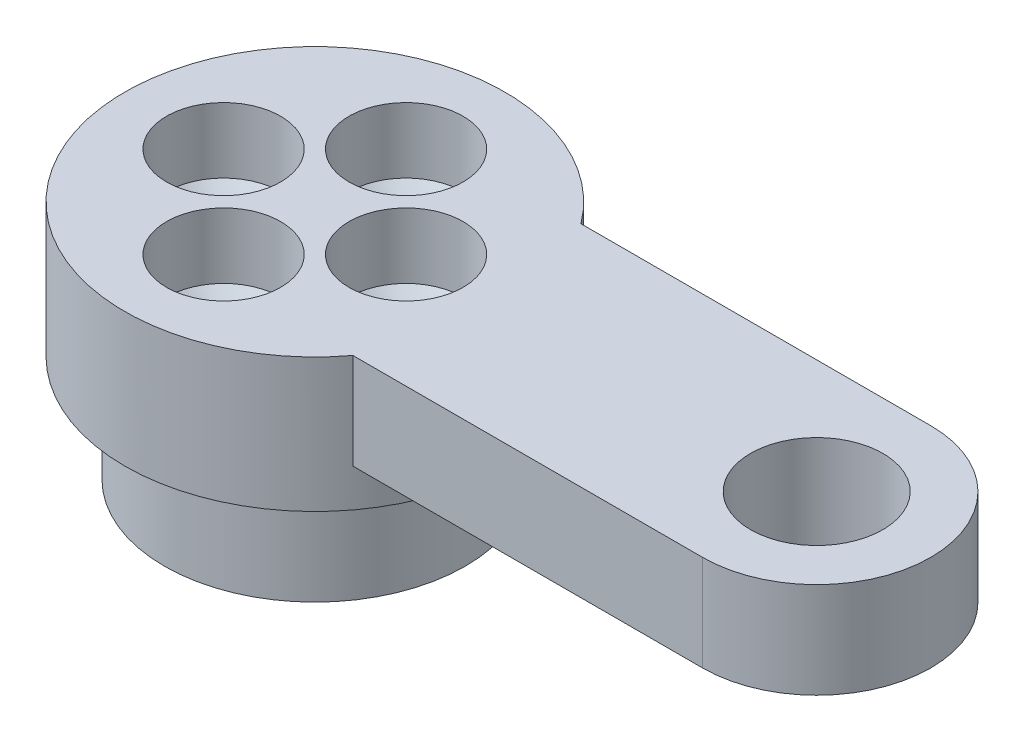
from build123d import *

# Parameters (mm, degrees)
SKETCH_1_R      = 9.9
SKETCH_1_R_2    = 1.85
EXTRUDE_1_DEPTH = 7
SKETCH_2_R      = 12.5
SKETCH_2_R_2    = 1.85
EXTRUDE_2_DEPTH = 2.5
SKETCH_3_R      = 3.75
EXTRUDE_3_DEPTH = 6.3
CHAMFER_1_SIZE  = 2


with BuildPart() as part:
    # 草图1 → 凸台-拉伸1 (new body)
    with BuildSketch(Plane(origin=(0, 0, 0), x_dir=(1, 0, 0), z_dir=(0, 1, 0))):
        with Locations(Location((0, 0, 0), (0, 0, 270))):
            Circle(SKETCH_1_R)
        with Locations(Location((6, 0, 0), (0, 0, 270))):
            Circle(SKETCH_1_R_2, mode=Mode.SUBTRACT)
        with Locations(Location((0, -6, 0), (0, 0, 270))):
            Circle(SKETCH_1_R_2, mode=Mode.SUBTRACT)
        with Locations(Location((-6, 0, 0), (0, 0, 270))):
            Circle(SKETCH_1_R_2, mode=Mode.SUBTRACT)
        with Locations(Location((0, 6, 0), (0, 0, 270))):
            Circle(SKETCH_1_R_2, mode=Mode.SUBTRACT)
    extrude(amount=EXTRUDE_1_DEPTH)

    # 草图2 → 凸台-拉伸2 (add)
    with BuildSketch(Plane(origin=(0, 7, 0), x_dir=(1, 0, 0), z_dir=(0, 1, 0))):
        with Locations(Location((0, 0, 0), (0, 0, 270))):
            Circle(SKETCH_2_R)
        with Locations(Location((-6, 0, 0), (0, 0, 270))):
            Circle(SKETCH_2_R_2, mode=Mode.SUBTRACT)
        with Locations(Location((0, -6, 0), (0, 0, 270))):
            Circle(SKETCH_2_R_2, mode=Mode.SUBTRACT)
        with Locations(Location((6, 0, 0), (0, 0, 270))):
            Circle(SKETCH_2_R_2, mode=Mode.SUBTRACT)
        with Locations(Location((0, 6, 0), (0, 0, 270))):
            Circle(SKETCH_2_R_2, mode=Mode.SUBTRACT)
    extrude(amount=EXTRUDE_2_DEPTH)

    # 草图3 → 凸台-拉伸3 (add)
    # profile 1 of 8: a face of its own
    with BuildSketch(Plane(origin=(0, 9.5, 0), x_dir=(1, 0, 0), z_dir=(0, 1, 0))):
        with BuildLine():
            Line((2.25, 0), (-2.25, 0))
            ThreePointArc((-2.25, 0), (-6, -3.75), (-9.75, 0))
            Line((-9.75, 0), (-12.5, 0))
            ThreePointArc((-12.5, 0), (-3.952847075, -11.858541226), (10, -7.5))
            ThreePointArc((10, -7.5), (11.858541226, -3.952847075), (12.5, 0))
            Line((12.5, 0), (9.75, 0))
            ThreePointArc((9.75, 0), (6, -3.75), (2.25, 0))
        make_face()
        with Locations(Location((0, -6, 0), (0, 0, 270))):
            Circle(SKETCH_3_R, mode=Mode.SUBTRACT)
    # profile 2 of 8: a face of its own
    with BuildSketch(Plane(origin=(0, 9.5, 0), x_dir=(1, 0, 0), z_dir=(0, 1, 0))):
        with BuildLine():
            ThreePointArc((-9.75, 0), (-6, 3.75), (-2.25, 0))
            Line((-2.25, 0), (2.25, 0))
            ThreePointArc((2.25, 0), (6, 3.75), (9.75, 0))
            Line((9.75, 0), (12.5, 0))
            ThreePointArc((12.5, 0), (11.858541226, 3.952847075), (10, 7.5))
            ThreePointArc((10, 7.5), (-3.952847075, 11.858541226), (-12.5, 0))
            Line((-12.5, 0), (-9.75, 0))
        make_face()
        with Locations(Location((0, 6, 0), (0, 0, 270))):
            Circle(SKETCH_3_R, mode=Mode.SUBTRACT)
    # profile 3 of 8: a face of its own
    with BuildSketch(Plane(origin=(0, 9.5, 0), x_dir=(1, 0, 0), z_dir=(0, 1, 0))):
        with BuildLine():
            ThreePointArc((10, 7.5), (11.858541226, 3.952847075), (12.5, 0))
            Line((12.5, 0), (25.5, 0))
            ThreePointArc((25.5, 0), (27.696699141, 5.303300859), (33, 7.5))
            Line((33, 7.5), (10, 7.5))
        make_face()
    # profile 4 of 8: a face of its own
    with BuildSketch(Plane(origin=(0, 9.5, 0), x_dir=(1, 0, 0), z_dir=(0, 1, 0))):
        with BuildLine():
            Line((25.5, 0), (12.5, 0))
            ThreePointArc((12.5, 0), (11.858541226, -3.952847075), (10, -7.5))
            Line((10, -7.5), (33, -7.5))
            ThreePointArc((33, -7.5), (27.696699141, -5.303300859), (25.5, 0))
        make_face()
    # profile 5 of 8: a face of its own
    with BuildSketch(Plane(origin=(0, 9.5, 0), x_dir=(1, 0, 0), z_dir=(0, 1, 0))):
        with BuildLine():
            ThreePointArc((33, 7.5), (27.696699141, 5.303300859), (25.5, 0))
            Line((25.5, 0), (28.65, 0))
            ThreePointArc((28.65, 0), (33, 4.35), (37.35, 0))
            Line((37.35, 0), (40.5, 0))
            ThreePointArc((40.5, 0), (38.303300859, 5.303300859), (33, 7.5))
        make_face()
    # profile 6 of 8: a face of its own
    with BuildSketch(Plane(origin=(0, 9.5, 0), x_dir=(1, 0, 0), z_dir=(0, 1, 0))):
        with BuildLine():
            Line((28.65, 0), (25.5, 0))
            ThreePointArc((25.5, 0), (27.696699141, -5.303300859), (33, -7.5))
            ThreePointArc((33, -7.5), (38.303300859, -5.303300859), (40.5, 0))
            Line((40.5, 0), (37.35, 0))
            ThreePointArc((37.35, 0), (33, -4.35), (28.65, 0))
        make_face()
    # profile 7 of 8: a face of its own
    with BuildSketch(Plane(origin=(0, 9.5, 0), x_dir=(1, 0, 0), z_dir=(0, 1, 0))):
        with BuildLine():
            ThreePointArc((33, 7.5), (27.696699141, 5.303300859), (25.5, 0))
            Line((25.5, 0), (28.65, 0))
            ThreePointArc((28.65, 0), (33, 4.35), (37.35, 0))
            Line((37.35, 0), (40.5, 0))
            ThreePointArc((40.5, 0), (38.303300859, 5.303300859), (33, 7.5))
        make_face()
    # profile 8 of 8: a face of its own
    with BuildSketch(Plane(origin=(0, 9.5, 0), x_dir=(1, 0, 0), z_dir=(0, 1, 0))):
        with BuildLine():
            Line((28.65, 0), (25.5, 0))
            ThreePointArc((25.5, 0), (27.696699141, -5.303300859), (33, -7.5))
            ThreePointArc((33, -7.5), (38.303300859, -5.303300859), (40.5, 0))
            Line((40.5, 0), (37.35, 0))
            ThreePointArc((37.35, 0), (33, -4.35), (28.65, 0))
        make_face()
    extrude(amount=EXTRUDE_3_DEPTH)

    # 倒角1
    # the kernel refuses this chamfer: 2 mm, written as the material it adds along each edge
    with BuildSketch(Plane(origin=(0, 9.5, 6), x_dir=(0, 0, 1), z_dir=(-1, 0, 0))) as chamfer_1_piece_1_section:
        Polygon((3.75 - CHAMFER_1_SIZE, 0), (3.75, CHAMFER_1_SIZE), (3.75, 0), align=None)
    chamfer_1_piece_1 = revolve(axis=Axis((0, 9.5, 6), (0, 1, 0)), mode=Mode.PRIVATE)
    chamfer_1_piece_1 = chamfer_1_piece_1 - Plane(origin=(0, 10.553600351, 6), x_dir=(0, 0, 1), z_dir=(0, -1, 0)) * Cylinder(1.85, 15, mode=Mode.PRIVATE)
    add(chamfer_1_piece_1)
    with BuildSketch(Plane(origin=(-6, 9.5, 0), x_dir=(-1, 0, 0), z_dir=(0, 0, 1))) as chamfer_1_piece_2_section:
        Polygon((3.75 - CHAMFER_1_SIZE, 0), (3.75, -CHAMFER_1_SIZE), (3.75, 0), align=None)
    chamfer_1_piece_2 = revolve(axis=Axis((-6, 9.5, 0), (0, -1, 0)), mode=Mode.PRIVATE)
    chamfer_1_piece_2 = chamfer_1_piece_2 - Plane(origin=(-6, 10.553600351, 0), x_dir=(0, 0, 1), z_dir=(0, -1, 0)) * Cylinder(1.85, 15, mode=Mode.PRIVATE)
    add(chamfer_1_piece_2)
    with BuildSketch(Plane(origin=(0, 9.5, -6), x_dir=(0, 0, 1), z_dir=(-1, 0, 0))) as chamfer_1_piece_3_section:
        Polygon((3.75 - CHAMFER_1_SIZE, 0), (3.75, CHAMFER_1_SIZE), (3.75, 0), align=None)
    chamfer_1_piece_3 = revolve(axis=Axis((0, 9.5, -6), (0, 1, 0)), mode=Mode.PRIVATE)
    chamfer_1_piece_3 = chamfer_1_piece_3 - Plane(origin=(0, 10.553600351, -6), x_dir=(0, 0, 1), z_dir=(0, -1, 0)) * Cylinder(1.85, 16, mode=Mode.PRIVATE)
    add(chamfer_1_piece_3)
    with BuildSketch(Plane(origin=(6, 9.5, 0), x_dir=(1, 0, 0), z_dir=(0, 0, -1))) as chamfer_1_piece_4_section:
        Polygon((3.75 - CHAMFER_1_SIZE, 0), (3.75, -CHAMFER_1_SIZE), (3.75, 0), align=None)
    chamfer_1_piece_4 = revolve(axis=Axis((6, 9.5, 0), (0, -1, 0)), mode=Mode.PRIVATE)
    chamfer_1_piece_4 = chamfer_1_piece_4 - Plane(origin=(6, 10.553600351, 0), x_dir=(0, 0, 1), z_dir=(0, -1, 0)) * Cylinder(1.85, 15, mode=Mode.PRIVATE)
    add(chamfer_1_piece_4)


solid = part.part
